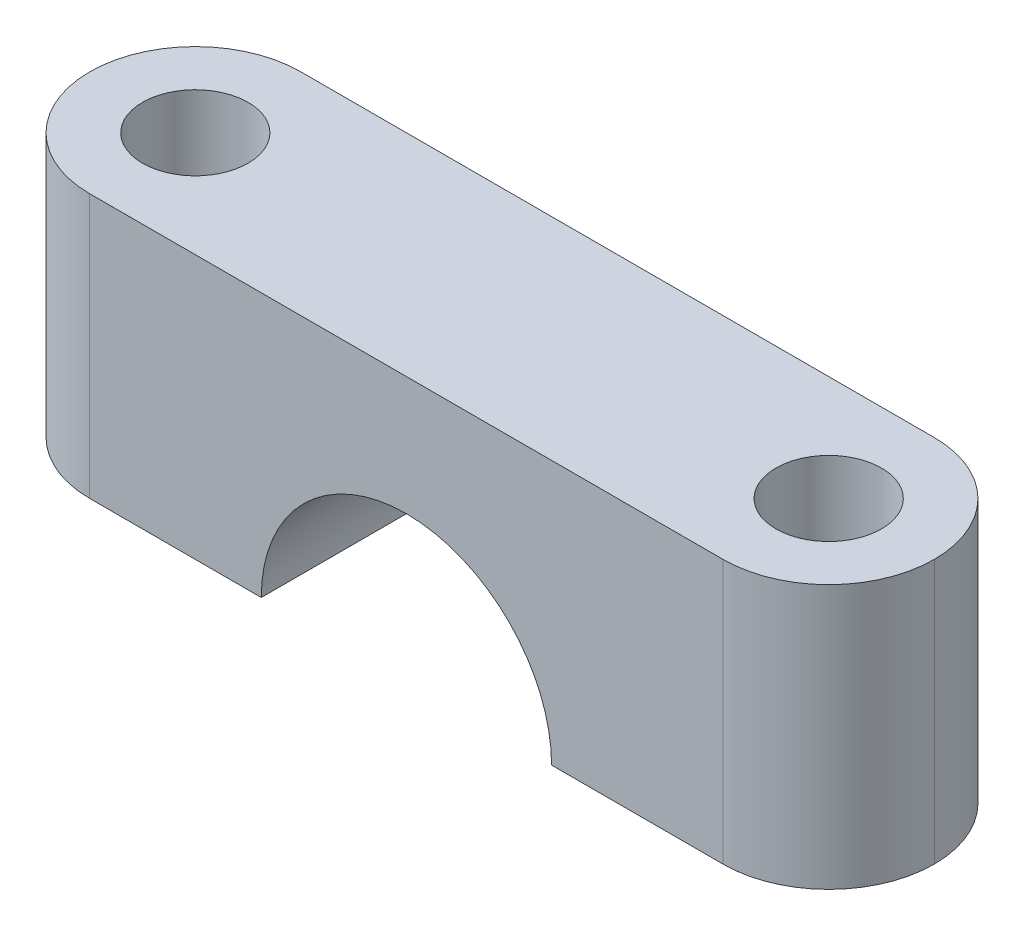
from build123d import *

# Parameters (mm, degrees)
BOSS_EXTRUDE1_DEPTH = 6.35
SKETCH2_R           = 3.175
CUT_EXTRUDE1_DEPTH  = 31.618591166
FILLET1_R           = 6.35


with BuildPart() as part:
    # Sketch1 → Boss-Extrude1 (new, symmetric)
    with BuildSketch(Plane.XY):
        with BuildLine():
            Line((-8.73125, 0), (-25.4, 0))
            Line((-25.4, 0), (-25.4, 15.875))
            Line((-25.4, 15.875), (25.4, 15.875))
            Line((25.4, 15.875), (25.4, 0))
            Line((25.4, 0), (8.73125, 0))
            ThreePointArc((8.73125, 0), (0, 8.73125), (-8.73125, 0))
        make_face()
    extrude(amount=BOSS_EXTRUDE1_DEPTH, both=True)

    # Sketch2 → Cut-Extrude1 (cut, through all)
    with BuildSketch(Plane(origin=(0, 0, 0), x_dir=(1, 0, 0), z_dir=(0, 1, 0))):
        with Locations(Location((-19.05, 0, 0), (0, 0, 270))):
            Circle(SKETCH2_R)
        with Locations(Location((19.05, 0, 0), (0, 0, 270))):
            Circle(SKETCH2_R)
    extrude(amount=CUT_EXTRUDE1_DEPTH, mode=Mode.SUBTRACT)

    # Fillet1
    fillet1_edges = [part.edges().sort_by_distance(p)[0] for p in [
        (25.4, 7.9375, -6.35),
        (25.4, 7.9375, 6.35),
        (-25.4, 7.9375, -6.35),
        (-25.4, 7.9375, 6.35),
    ]]
    fillet(fillet1_edges, radius=FILLET1_R - 0.0001)  # a hair under: the kernel refuses the full size


solid = part.part
